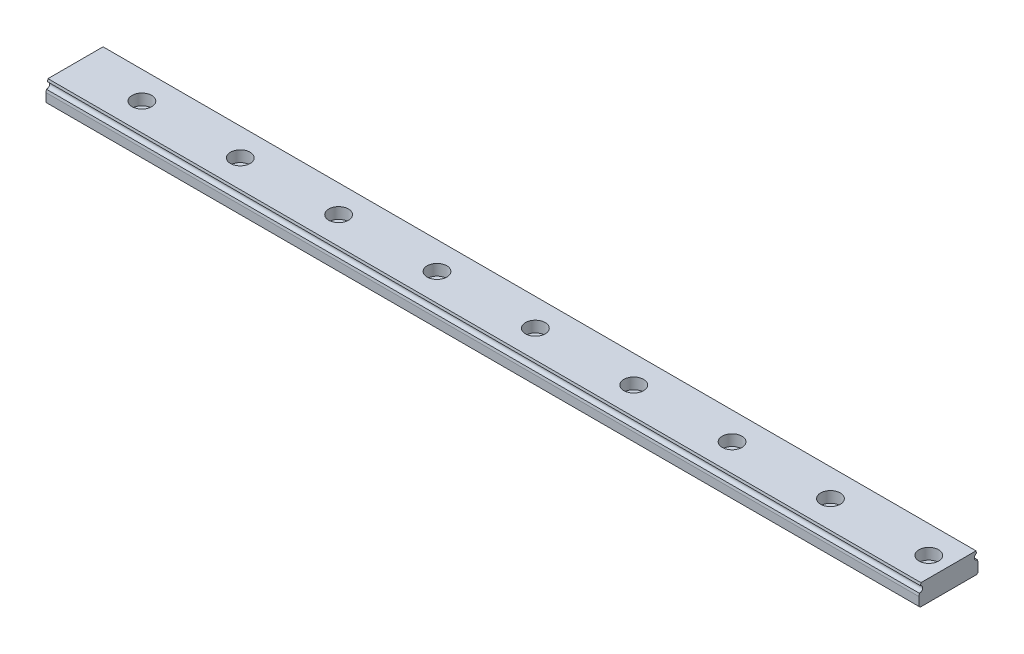
from build123d import *

# Parameters (mm, degrees)
RESSALTO_EXTRUS_O1_DEPTH      = 263
RESSALTO_EXTRUS_O1_DEPTH_BACK = 92
LPATTERN1_COUNT               = 6
LPATTERN1_PITCH               = 40
LPATTERN1_COUNT_DIR2          = 4
LPATTERN1_PITCH_DIR2          = 40


with BuildPart() as part:
    # Esboço1 → Ressalto-extrusão1 (new, two sides: drawn at the far end of the back side and taken through both)
    with BuildSketch(Plane(origin=(-15, 0, 0), x_dir=(0, 0, -1), z_dir=(1, 0, 0)).offset(-RESSALTO_EXTRUS_O1_DEPTH_BACK)):
        with BuildLine():
            Line((-12, 4), (-12, 0.5))
            Line((-12, 0.5), (-11.5, 0))
            Line((-11.5, 0), (11.5, 0))
            Line((11.5, 0), (12, 0.5))
            Line((12, 0.5), (12, 4))
            Line((12, 4), (11.814562479, 5.051668439))
            ThreePointArc((11.814562479, 5.051668439), (10.518990309, 6.082939778), (11.383714346, 7.495129625))
            Line((11.383714346, 7.495129625), (11.206528587, 8.5))
            Line((11.206528587, 8.5), (-11.206528587, 8.5))
            Line((-11.206528587, 8.5), (-11.383714346, 7.495129625))
            ThreePointArc((-11.383714346, 7.495129625), (-10.518990309, 6.082939778), (-11.814562479, 5.051668439))
            Line((-11.814562479, 5.051668439), (-12, 4))
        make_face()
    extrude(amount=RESSALTO_EXTRUS_O1_DEPTH + RESSALTO_EXTRUS_O1_DEPTH_BACK)

    # Esboço3 → Corte-Revolução2 (revolve, cut)
    with BuildSketch(Plane.XY):
        Polygon((40, 8.5), (44, 8.5), (44, 4), (42.25, 4), (42.25, 0), (40, 0), align=None)
    corte_revolu_o2 = revolve(axis=Axis((40, 0, 0), (0, 1, 0)), mode=Mode.SUBTRACT)

    # LPattern1: Corte-Revolu_o2 6 × 4
    with Locations(*[Vector(1, 0, 0) * (i * LPATTERN1_PITCH) + Vector(-1, 0, 0) * (j * LPATTERN1_PITCH_DIR2) for i in range(LPATTERN1_COUNT) for j in range(LPATTERN1_COUNT_DIR2) if (i, j) != (0, 0)]):
        add(corte_revolu_o2, mode=Mode.SUBTRACT)


solid = part.part
